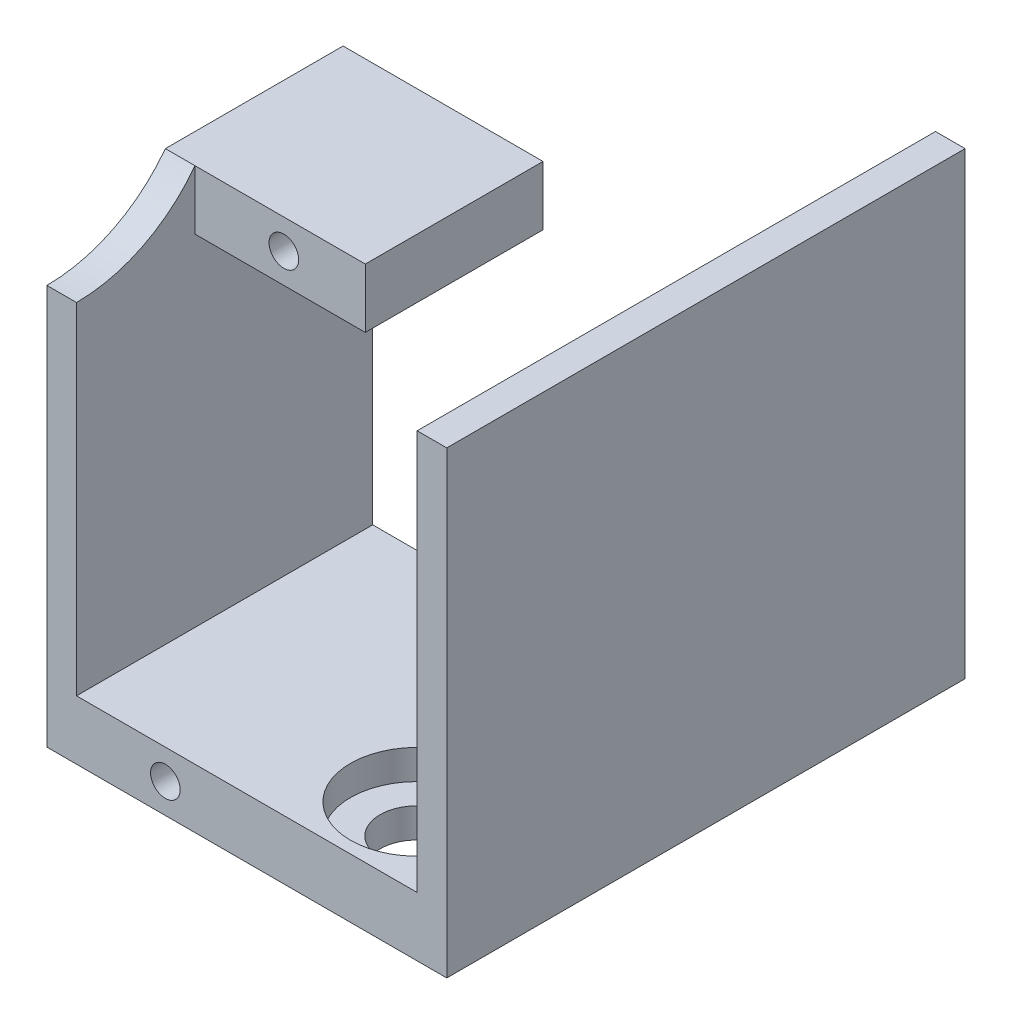
from build123d import *

# Parameters (mm, degrees)
SKETCH1_W           = 20
SKETCH1_H           = 20
SKETCH1_R           = 2.5
BOSS_EXTRUDE1_DEPTH = 2
SKETCH2_W           = 20
SKETCH2_H           = 20
SKETCH2_R           = 4.5
BOSS_EXTRUDE2_DEPTH = 2
SKETCH6_W           = 3
SKETCH6_H           = 20
BOSS_EXTRUDE4_DEPTH = 4
SKETCH4_W           = 20
SKETCH4_H           = 27
BOSS_EXTRUDE3_DEPTH = 2
SKETCH5_R           = 1
CUT_EXTRUDE1_DEPTH  = 20
SKETCH7_W           = 13.5
SKETCH7_H           = 12
BOSS_EXTRUDE5_DEPTH = 4
FILLET3_R           = 10
SKETCH9_W           = 35
SKETCH9_H           = 31
BOSS_EXTRUDE6_DEPTH = 2


with BuildPart() as part:
    # Sketch1 → Boss-Extrude1 (new body)
    with BuildSketch(Plane(origin=(0, 0, 0), x_dir=(1, 0, 0), z_dir=(0, 1, 0))):
        Rectangle(SKETCH1_W, SKETCH1_H)
        with Locations(Location((4.696699141, -4.696699141, 0), (0, 0, 90))):
            Circle(SKETCH1_R, mode=Mode.SUBTRACT)
        with Locations(Location((4.696699141, 4.696699141, 0), (0, 0, 90))):
            Circle(SKETCH1_R, mode=Mode.SUBTRACT)
    extrude(amount=BOSS_EXTRUDE1_DEPTH)

    # Sketch2 → Boss-Extrude2 (add)
    with BuildSketch(Plane(origin=(0, 2, 0), x_dir=(1, 0, 0), z_dir=(0, 1, 0))):
        Rectangle(SKETCH2_W, SKETCH2_H)
        with Locations(Location((4.696699141, -4.696699141, 0), (0, 0, 270))):
            Circle(SKETCH2_R, mode=Mode.SUBTRACT)
        with Locations(Location((4.696699141, 4.696699141, 0), (0, 0, 270))):
            Circle(SKETCH2_R, mode=Mode.SUBTRACT)
    extrude(amount=BOSS_EXTRUDE2_DEPTH)

    # Sketch6 → Boss-Extrude4 (add)
    with BuildSketch(Plane(origin=(0, 4, 0), x_dir=(1, 0, 0), z_dir=(0, 1, 0))):
        with Locations((-11.5, 0)):
            Rectangle(SKETCH6_W, SKETCH6_H)
    extrude(amount=-BOSS_EXTRUDE4_DEPTH)

    # Sketch4 → Boss-Extrude3 (add)
    with BuildSketch(Plane.ZY.offset(13)):
        with Locations((0, 13.5)):
            Rectangle(SKETCH4_W, SKETCH4_H)
    extrude(amount=BOSS_EXTRUDE3_DEPTH)

    # Sketch5 → Cut-Extrude1 (cut)
    with BuildSketch(Plane(origin=(0, 0, -10), x_dir=(-1, 0, 0), z_dir=(0, 0, -1))):
        with Locations((7, 2)):
            Circle(SKETCH5_R)
    cut_extrude1 = extrude(amount=-CUT_EXTRUDE1_DEPTH, mode=Mode.SUBTRACT)

    # Sketch7 → Boss-Extrude5 (add)
    with BuildSketch(Plane(origin=(0, 27, 0), x_dir=(1, 0, 0), z_dir=(0, 1, 0))):
        with Locations((-8.25, 4)):
            Rectangle(SKETCH7_W, SKETCH7_H)
    extrude(amount=BOSS_EXTRUDE5_DEPTH)

    # Mirror1: Cut-Extrude1 across plane
    add(cut_extrude1.mirror(Plane.ZX.offset(15.5)), mode=Mode.SUBTRACT)

    # Fillet3
    # the kernel refuses this fillet: 10 mm, written as the material it adds along each edge
    with BuildSketch(Plane(origin=(-13, 27, 2), x_dir=(0, 0, 1), z_dir=(-1, 0, 0))) as fillet3_piece_1:
        with BuildLine():
            CenterArc((8, 10), FILLET3_R, 216.869897646, 53.130102354)
            Line((0, 4), (0, 0))
            Line((0, 0), (8, 0))
        make_face()
    extrude(amount=2)

    # Sketch9 → Boss-Extrude6 (add)
    with BuildSketch(Plane(origin=(10, 0, 0), x_dir=(0, 0, -1), z_dir=(1, 0, 0))):
        with Locations((7.5, 15.5)):
            Rectangle(SKETCH9_W, SKETCH9_H)
    extrude(amount=BOSS_EXTRUDE6_DEPTH)


solid = part.part
